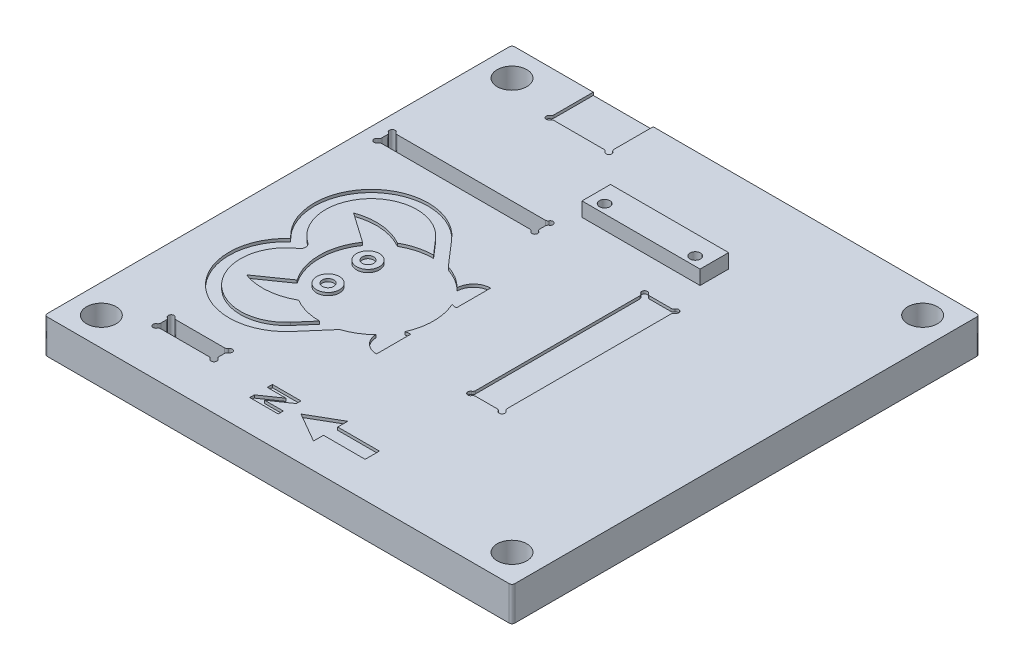
from build123d import *

# Parameters (mm, degrees)
SKICA1_W                        = 164
SKICA1_H                        = 164
P_IDAT_VYSUNUT_M1_DEPTH         = 12
SKICA2_R                        = 5.2
ODEBRAT_VYSUNUT_M1_DEPTH        = 117.584733134
SKICA3_W                        = 55.4
SKICA3_H                        = 5.4
SKICA3_W_2                      = 20.4
ODEBRAT_VYSUNUT_M2_DEPTH        = 117.584733134
ODEBRAT_VYSUNUT_M3_DEPTH        = 1
ZAOBLIT1_R                      = 1
SKICA10_W                       = 41.4
SKICA10_H                       = 10
P_IDAT_VYSUNUT_M2_DEPTH         = 5
ODEBRAT_VYSUNUT_M6_DEPTH        = 117.584733134
ODEBRAT_VYSUNUT_M6_DEPTH_BACK   = 117.584733134
SKICA10_3_R                     = 1.85
SKICA11_W                       = 21
SKICA11_H                       = 15.5
SKICA11_W_2                     = 11
SKICA11_H_2                     = 61
ODEBRAT_VYSUNUT_M7_DEPTH        = 1
SKICA12_R                       = 1
ODEBRAT_VYSUNUT_M8_DEPTH        = 117.584733134
ZAOBLIT2_R                      = 1
SKICA13_R                       = 1
ODEBRAT_VYSUNUT_M9_DEPTH        = 1
ZAOBLIT3_R                      = 1
ODEBRAT_START                   = 11
ODEBRAT_VYSUNUT_M11_OUTLINE_R   = 4
ODEBRAT_VYSUNUT_M11_OUTLINE_R_2 = 2
ODEBRAT_VYSUNUT_M11_DEPTH       = 1


# Read off the part's stored shape, not the designer's step: Odebrat vysunutím11
with BuildPart() as part:
    # Skica1 → Přidat vysunutím1 (new body)
    with BuildSketch(Plane(origin=(0, 0, 0), x_dir=(1, 0, 0), z_dir=(0, 1, 0))):
        Rectangle(SKICA1_W, SKICA1_H)
    extrude(amount=P_IDAT_VYSUNUT_M1_DEPTH)

    # Skica2 → Odebrat vysunutím1 (cut, through all)
    with BuildSketch(Plane(origin=(0, 12, 0), x_dir=(1, 0, 0), z_dir=(0, 1, 0))):
        with Locations(Location((-72, 72, 0), (0, 0, 270))):
            Circle(SKICA2_R)
        with Locations(Location((72, 72, 0), (0, 0, 270))):
            Circle(SKICA2_R)
        with Locations(Location((-72, -72, 0), (0, 0, 270))):
            Circle(SKICA2_R)
        with Locations(Location((72, -72, 0), (0, 0, 270))):
            Circle(SKICA2_R)
    extrude(amount=-ODEBRAT_VYSUNUT_M1_DEPTH, mode=Mode.SUBTRACT)

    # Skica3 → Odebrat vysunutím2 (cut, through all)
    with BuildSketch(Plane(origin=(0, 12, 0), x_dir=(1, 0, 0), z_dir=(0, 1, 0))):
        with Locations((-49, 32)):
            Rectangle(SKICA3_W, SKICA3_H)
        with Locations((-49, -63)):
            Rectangle(SKICA3_W_2, SKICA3_H)
    extrude(amount=-ODEBRAT_VYSUNUT_M2_DEPTH, mode=Mode.SUBTRACT)

    # Skica4 → Odebrat vysunutím3 (cut)
    with BuildSketch(Plane(origin=(0, 12, 0), x_dir=(1, 0, 0), z_dir=(0, 1, 0))):
        Polygon((3.392304845, -61), (-7, -67), (3.392304845, -73), (3.392304845, -69.5), (18, -69.5), (18, -64.5), (3.392304845, -64.5), align=None)
        Polygon((-11, -63.025641026), (-11, -64.642227564), (-17.580528846, -69.179487179), (-11, -69.179487179), (-11, -70.974358974), (-21, -70.974358974), (-21, -69.345753205), (-14.439503205, -64.820512821), (-21, -64.820512821), (-21, -63.025641026), align=None)
    extrude(amount=-ODEBRAT_VYSUNUT_M3_DEPTH, mode=Mode.SUBTRACT)

    # Zaoblit1
    zaoblit1_edges = [part.edges().sort_by_distance(p)[0] for p in [
        (82, 6, 82),
        (-82, 6, 82),
        (-82, 6, -82),
        (82, 6, -82),
    ]]
    fillet(zaoblit1_edges, radius=ZAOBLIT1_R)

    # Skica10 → Přidat vysunutím2 (add)
    with BuildSketch(Plane(origin=(0, 12, 0), x_dir=(1, 0, 0), z_dir=(0, 1, 0))):
        with Locations((3.25, 47)):
            Rectangle(SKICA10_W, SKICA10_H)
    extrude(amount=P_IDAT_VYSUNUT_M2_DEPTH)

    # Skica10<3> → Odebrat vysunutím6 (cut, two sides: drawn at the far end of the back side and taken through both)
    with BuildSketch(Plane(origin=(0, 12, 0), x_dir=(1, 0, 0), z_dir=(0, 1, 0)).offset(-ODEBRAT_VYSUNUT_M6_DEPTH_BACK)):
        with Locations(Location((-12.625, 45.13, 0), (0, 0, 270))):
            Circle(SKICA10_3_R)
        with Locations(Location((19.125, 45.13, 0), (0, 0, 270))):
            Circle(SKICA10_3_R)
    extrude(amount=ODEBRAT_VYSUNUT_M6_DEPTH + ODEBRAT_VYSUNUT_M6_DEPTH_BACK, mode=Mode.SUBTRACT)

    # Skica11 → Odebrat vysunutím7 (cut)
    with BuildSketch(Plane(origin=(0, 12, 0), x_dir=(1, 0, 0), z_dir=(0, 1, 0))):
        with Locations((-43, 74.25)):
            Rectangle(SKICA11_W, SKICA11_H)
        with Locations((22, -0.5)):
            Rectangle(SKICA11_W_2, SKICA11_H_2)
    extrude(amount=-ODEBRAT_VYSUNUT_M7_DEPTH, mode=Mode.SUBTRACT)

    # Skica12 → Odebrat vysunutím8 (cut, through all)
    with BuildSketch(Plane(origin=(0, 12, 0), x_dir=(1, 0, 0), z_dir=(0, 1, 0))):
        with Locations((-76.7, 34.7)):
            Circle(SKICA12_R)
        with Locations((-76.7, 29.3)):
            Circle(SKICA12_R)
        with Locations((-21.3, 29.3)):
            Circle(SKICA12_R)
        with Locations((-21.3, 34.7)):
            Circle(SKICA12_R)
        with Locations((-59.2, -60.3)):
            Circle(SKICA12_R)
        with Locations((-59.2, -65.7)):
            Circle(SKICA12_R)
        with Locations((-38.8, -65.7)):
            Circle(SKICA12_R)
        with Locations((-38.8, -60.3)):
            Circle(SKICA12_R)
    extrude(amount=-ODEBRAT_VYSUNUT_M8_DEPTH, mode=Mode.SUBTRACT)

    # Zaoblit2
    zaoblit2_edges = [part.edges().sort_by_distance(p)[0] for p in [
        (-75.7, 6, -34.7),
        (-22.3, 6, -34.7),
        (-76.7, 6, -30.3),
        (-22.3, 6, -29.3),
        (-39.8, 6, 60.3),
        (-58.2, 6, 60.3),
        (-59.2, 6, 64.7),
        (-39.8, 6, 65.7),
        (-59.2, 6, 61.3),
        (-21.3, 6, -33.7),
        (-21.3, 6, -30.3),
        (-75.7, 6, -29.3),
        (-58.2, 6, 65.7),
        (-38.8, 6, 64.7),
        (-38.8, 6, 61.3),
        (-76.7, 6, -33.7),
    ]]
    fillet(zaoblit2_edges, radius=ZAOBLIT2_R)

    # Skica13 → Odebrat vysunutím9 (cut)
    with BuildSketch(Plane(origin=(0, 12, 0), x_dir=(1, 0, 0), z_dir=(0, 1, 0))):
        with Locations((-53.5, 66.5)):
            Circle(SKICA13_R)
        with Locations((-32.5, 66.5)):
            Circle(SKICA13_R)
        with Locations((16.5, 30)):
            Circle(SKICA13_R)
        with Locations((27.5, 30)):
            Circle(SKICA13_R)
        with Locations((16.5, -31)):
            Circle(SKICA13_R)
        with Locations((27.5, -31)):
            Circle(SKICA13_R)
    extrude(amount=-ODEBRAT_VYSUNUT_M9_DEPTH, mode=Mode.SUBTRACT)

    # Zaoblit3
    zaoblit3_edges = [part.edges().sort_by_distance(p)[0] for p in [
        (-53.5, 11.5, -67.5),
        (-52.5, 11.5, -66.5),
        (27.5, 11.5, 30),
        (26.5, 11.5, 31),
        (-32.5, 11.5, -67.5),
        (-33.5, 11.5, -66.5),
        (16.5, 11.5, -29),
        (17.5, 11.5, -30),
        (26.5, 11.5, -30),
        (27.5, 11.5, -29),
        (16.5, 11.5, 30),
        (17.5, 11.5, 31),
    ]]
    fillet(zaoblit3_edges, radius=ZAOBLIT3_R)

    # Odebrat vysunutím11 outline → Odebrat vysunutím11 (cut)
    # profile 1 of 3: a face of its own
    with BuildSketch(Plane(origin=(0, 0, 0), x_dir=(1, 0, 0), z_dir=(0, 1, 0)).offset(ODEBRAT_START)):
        with BuildLine():
            ThreePointArc((-25.86889032, -34.537055815), (-21.651463985, -32.614549434), (-17.989824292, -29.772875555))
            ThreePointArc((-17.989824292, -29.772875555), (-16.143608013, -33.837823652), (-12, -35.5))
            Line((-12, -35.5), (-12, -23.508301528))
            ThreePointArc((-12, -23.508301528), (-12.908552323, -23.577537842), (-13.796121859, -23.783647786))
            ThreePointArc((-13.796121859, -23.783647786), (-12, -15.5), (-13.796121859, -7.216352214))
            ThreePointArc((-13.796121859, -7.216352214), (-12.908552323, -7.422462158), (-12, -7.491698472))
            Line((-12, -7.491698472), (-12, 4.5))
            ThreePointArc((-12, 4.5), (-16.143608013, 2.837823652), (-17.989824292, -1.227124445))
            ThreePointArc((-17.989824292, -1.227124445), (-21.651463985, 1.614549434), (-25.86889032, 3.537055815))
            Line((-25.86889032, 3.537055815), (-33.674320761, 12.533542588))
            ThreePointArc((-33.674320761, 12.533542588), (-62.826546549, 13.664932048), (-62.092346854, -15.5))
            ThreePointArc((-62.092346854, -15.5), (-62.826546549, -44.664932048), (-33.674320761, -43.533542588))
            Line((-33.674320761, -43.533542588), (-25.86889032, -34.537055815))
        make_face()
        with Locations((-42, -22.502075382)):
            Circle(ODEBRAT_VYSUNUT_M11_OUTLINE_R, mode=Mode.SUBTRACT)
        with BuildLine():
            ThreePointArc((-57.722697741, -17.158534068), (-56.840402867, -15.5), (-57.722697741, -13.841465932))
            ThreePointArc((-57.722697741, -13.841465932), (-60.761452982, 10.031999011), (-36.695667957, 9.912195392))
            Line((-36.695667957, 9.912195392), (-32, 4.5))
            ThreePointArc((-32, 4.5), (-37.176380902, 3.818516526), (-42, 1.820508076))
            ThreePointArc((-42, 1.820508076), (-50.256885145, 4.423893962), (-58.840402867, 3.293852416))
            Line((-58.840402867, 3.293852416), (-48.383040886, -4.028471273))
            ThreePointArc((-48.383040886, -4.028471273), (-52, -15.5), (-48.383040886, -26.971528727))
            Line((-48.383040886, -26.971528727), (-58.840402867, -34.293852416))
            ThreePointArc((-58.840402867, -34.293852416), (-50.256885145, -35.423893962), (-42, -32.820508076))
            ThreePointArc((-42, -32.820508076), (-37.176380902, -34.818516526), (-32, -35.5))
            Line((-32, -35.5), (-36.695667957, -40.912195392))
            ThreePointArc((-36.695667957, -40.912195392), (-60.761452982, -41.031999011), (-57.722697741, -17.158534068))
        make_face(mode=Mode.SUBTRACT)
        with Locations((-42, -8.497924618)):
            Circle(ODEBRAT_VYSUNUT_M11_OUTLINE_R, mode=Mode.SUBTRACT)
    # profile 2 of 3: a face of its own
    with BuildSketch(Plane(origin=(0, 0, 0), x_dir=(1, 0, 0), z_dir=(0, 1, 0)).offset(ODEBRAT_START)):
        with Locations((-42, -22.502075382)):
            Circle(ODEBRAT_VYSUNUT_M11_OUTLINE_R_2)
    # profile 3 of 3: a face of its own
    with BuildSketch(Plane(origin=(0, 0, 0), x_dir=(1, 0, 0), z_dir=(0, 1, 0)).offset(ODEBRAT_START)):
        with Locations((-42, -8.497924618)):
            Circle(ODEBRAT_VYSUNUT_M11_OUTLINE_R_2)
    extrude(amount=ODEBRAT_VYSUNUT_M11_DEPTH, mode=Mode.SUBTRACT)


solid = part.part
